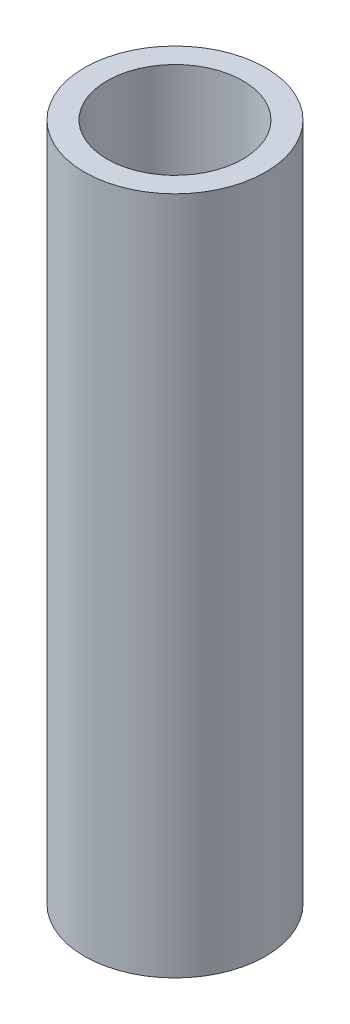
from build123d import *

# Parameters (mm, degrees)
SKETCH1_R           = 12.7
SKETCH1_R_2         = 9.525
BOSS_EXTRUDE1_DEPTH = 95.25


with BuildPart() as part:
    # Sketch1 → Boss-Extrude1 (new body)
    with BuildSketch(Plane(origin=(0, 0, 0), x_dir=(1, 0, 0), z_dir=(0, 1, 0))):
        with Locations((-11.39551051, 5.65506576)):
            Circle(SKETCH1_R)
        with Locations((-11.39551051, 5.65506576)):
            Circle(SKETCH1_R_2, mode=Mode.SUBTRACT)
    extrude(amount=BOSS_EXTRUDE1_DEPTH)


solid = part.part
